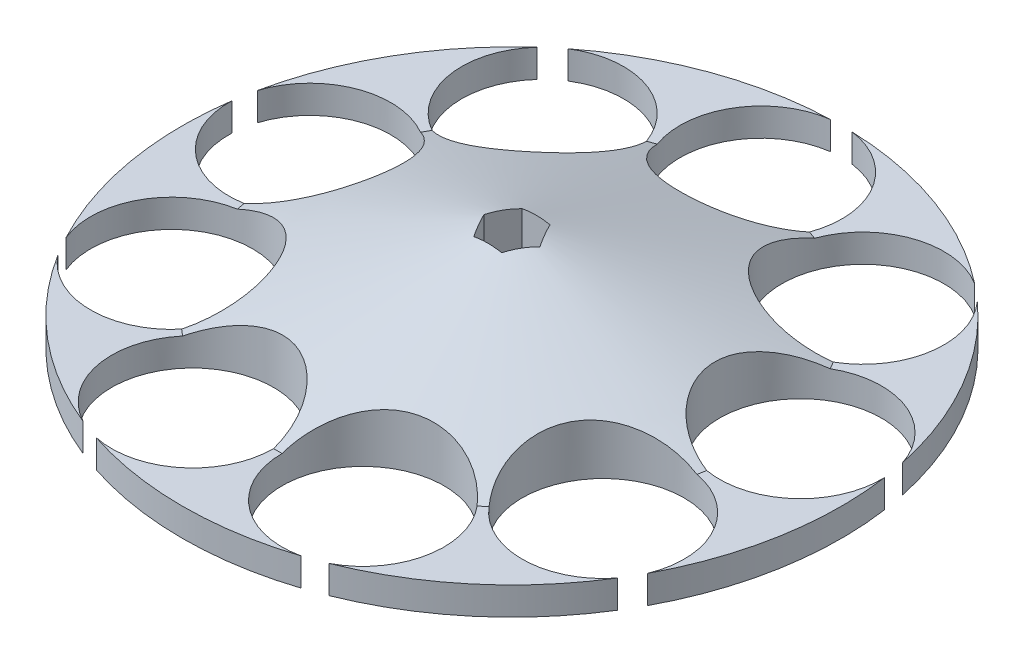
from build123d import *

# Parameters (mm, degrees)
SKETCH1_R           = 8.255
BOSS_EXTRUDE1_DEPTH = 5.08
BOSS_EXTRUDE4_DEPTH = 6.35
CUT_EXTRUDE1_DEPTH  = 21.59
CUT_EXTRUDE2_DEPTH  = 111.263503509
SKETCH7_W           = 16.51
SKETCH7_H           = 5.08
CUT_EXTRUDE3_DEPTH  = 17.78
CUT_EXTRUDE4_DEPTH  = 26.67


with BuildPart() as part:
    # Sketch1 → Boss-Extrude1 (new body)
    with BuildSketch(Plane(origin=(0, 0, 0), x_dir=(1, 0, 0), z_dir=(0, 1, 0))):
        Circle(SKETCH1_R)
        with BuildLine():
            Line((1.984169249, -1.524), (1.984169249, 1.524))
            ThreePointArc((1.984169249, 1.524), (-2.5019, 0), (1.984169249, -1.524))
        make_face(mode=Mode.SUBTRACT)
    extrude(amount=BOSS_EXTRUDE1_DEPTH)

    # Sketch7 → Cut-Extrude3 (cut, symmetric)
    with BuildSketch(Plane.XY):
        with Locations((0, 2.54)):
            Rectangle(SKETCH7_W, SKETCH7_H)
    extrude(amount=CUT_EXTRUDE3_DEPTH, both=True, mode=Mode.SUBTRACT)


with BuildPart() as body_2:
    # Sketch5 → Boss-Extrude4 (new body)
    with BuildSketch(Plane(origin=(0, 5.08, 0), x_dir=(1, 0, 0), z_dir=(0, 1, 0))):
        with BuildLine():
            ThreePointArc((66.09707744, -35.294209919), (73.791644933, -13.011457953), (74.182266661, 10.559176718))
            ThreePointArc((74.182266661, 10.559176718), (37.646245974, 6.638048888), (73.31997971, 15.449449032))
            ThreePointArc((73.31997971, 15.449449032), (64.891283506, 37.465), (50.039605191, 55.772240517))
            ThreePointArc((50.039605191, 55.772240517), (24.571841955, 29.283580927), (46.235648612, 58.96413908))
            ThreePointArc((46.235648612, 58.96413908), (25.627569339, 70.411168075), (2.482856324, 74.888853139))
            ThreePointArc((2.482856324, 74.888853139), (0, 38.227), (-2.482856324, 74.888853139))
            ThreePointArc((-2.482856324, 74.888853139), (-25.627569339, 70.411168075), (-46.235648612, 58.96413908))
            ThreePointArc((-46.235648612, 58.96413908), (-24.571841955, 29.283580927), (-50.039605191, 55.772240517))
            ThreePointArc((-50.039605191, 55.772240517), (-64.891283506, 37.465), (-73.31997971, 15.449449032))
            ThreePointArc((-73.31997971, 15.449449032), (-37.646245974, 6.638048888), (-74.182266661, 10.559176718))
            ThreePointArc((-74.182266661, 10.559176718), (-73.791644933, -13.011457953), (-66.09707744, -35.294209919))
            ThreePointArc((-66.09707744, -35.294209919), (-33.10555311, -19.1135), (-63.614221117, -39.59464322))
            ThreePointArc((-63.614221117, -39.59464322), (-48.164075594, -57.399710123), (-27.94661805, -69.523315798))
            ThreePointArc((-27.94661805, -69.523315798), (-13.074404019, -35.921629815), (-23.280374518, -71.221689549))
            ThreePointArc((-23.280374518, -71.221689549), (0, -74.93), (23.280374518, -71.221689549))
            ThreePointArc((23.280374518, -71.221689549), (13.074404019, -35.921629815), (27.94661805, -69.523315798))
            ThreePointArc((27.94661805, -69.523315798), (48.164075594, -57.399710123), (63.614221117, -39.59464322))
            ThreePointArc((63.614221117, -39.59464322), (33.10555311, -19.1135), (66.09707744, -35.294209919))
        make_face()
        with BuildLine():
            Line((1.984169249, 1.524), (1.984169249, -1.524))
            ThreePointArc((1.984169249, -1.524), (-2.5019, 0), (1.984169249, 1.524))
        make_face(mode=Mode.SUBTRACT)
    extrude(amount=BOSS_EXTRUDE4_DEPTH)

    # Sketch6 → Revolve1 (revolve)
    with BuildSketch(Plane(origin=(0, 0, 0), x_dir=(0, 0, -1), z_dir=(1, 0, 0))):
        Polygon((0, 30.48), (-53.226069427, 11.43), (0, 11.43), align=None)
    revolve(axis=Axis((0, 11.43, 0), (0, 1, 0)))

    # Sketch5<3> → Cut-Extrude1 (cut)
    with BuildSketch(Plane(origin=(0, 5.08, 0), x_dir=(1, 0, 0), z_dir=(0, 1, 0))):
        with BuildLine():
            ThreePointArc((73.31997971, 15.449449032), (37.646245974, 6.638048888), (74.182266661, 10.559176718))
            ThreePointArc((74.182266661, 10.559176718), (73.791644933, 13.011457953), (73.31997971, 15.449449032))
        make_face()
        with BuildLine():
            ThreePointArc((63.614221117, -39.59464322), (64.891283506, -37.465), (66.09707744, -35.294209919))
            ThreePointArc((66.09707744, -35.294209919), (33.10555311, -19.1135), (63.614221117, -39.59464322))
        make_face()
        with BuildLine():
            ThreePointArc((46.235648612, 58.96413908), (24.571841955, 29.283580927), (50.039605191, 55.772240517))
            ThreePointArc((50.039605191, 55.772240517), (48.164075594, 57.399710123), (46.235648612, 58.96413908))
        make_face()
        with BuildLine():
            ThreePointArc((23.280374518, -71.221689549), (25.627569339, -70.411168075), (27.94661805, -69.523315798))
            ThreePointArc((27.94661805, -69.523315798), (13.074404019, -35.921629815), (23.280374518, -71.221689549))
        make_face()
        with BuildLine():
            ThreePointArc((-2.482856324, 74.888853139), (0, 38.227), (2.482856324, 74.888853139))
            ThreePointArc((2.482856324, 74.888853139), (0, 74.93), (-2.482856324, 74.888853139))
        make_face()
        with BuildLine():
            ThreePointArc((-27.94661805, -69.523315798), (-25.627569339, -70.411168075), (-23.280374518, -71.221689549))
            ThreePointArc((-23.280374518, -71.221689549), (-13.074404019, -35.921629815), (-27.94661805, -69.523315798))
        make_face()
        with BuildLine():
            ThreePointArc((-50.039605191, 55.772240517), (-24.571841955, 29.283580927), (-46.235648612, 58.96413908))
            ThreePointArc((-46.235648612, 58.96413908), (-48.164075594, 57.399710123), (-50.039605191, 55.772240517))
        make_face()
        with BuildLine():
            ThreePointArc((-66.09707744, -35.294209919), (-64.891283506, -37.465), (-63.614221117, -39.59464322))
            ThreePointArc((-63.614221117, -39.59464322), (-33.10555311, -19.1135), (-66.09707744, -35.294209919))
        make_face()
        with BuildLine():
            ThreePointArc((-74.182266661, 10.559176718), (-37.646245974, 6.638048888), (-73.31997971, 15.449449032))
            ThreePointArc((-73.31997971, 15.449449032), (-73.791644933, 13.011457953), (-74.182266661, 10.559176718))
        make_face()
    extrude(amount=CUT_EXTRUDE1_DEPTH, mode=Mode.SUBTRACT)

    # Sketch1<2> → Cut-Extrude2 (cut, through all)
    with BuildSketch(Plane(origin=(0, 0, 0), x_dir=(1, 0, 0), z_dir=(0, 1, 0))):
        with BuildLine():
            ThreePointArc((1.984169249, 1.524), (-2.5019, 0), (1.984169249, -1.524))
            Line((1.984169249, -1.524), (1.984169249, 1.524))
        make_face()
    extrude(amount=CUT_EXTRUDE2_DEPTH, mode=Mode.SUBTRACT)

    # Sketch8 → Cut-Extrude4 (cut, symmetric)
    with BuildSketch(Plane.XZ.offset(-5.08)):
        Polygon((-3.175, -5.499261314), (3.175, -5.499261314), (6.35, 0), (3.175, 5.499261314), (-3.175, 5.499261314), (-6.35, 0), align=None)
    extrude(amount=CUT_EXTRUDE4_DEPTH, both=True, mode=Mode.SUBTRACT)


solid = body_2.part
